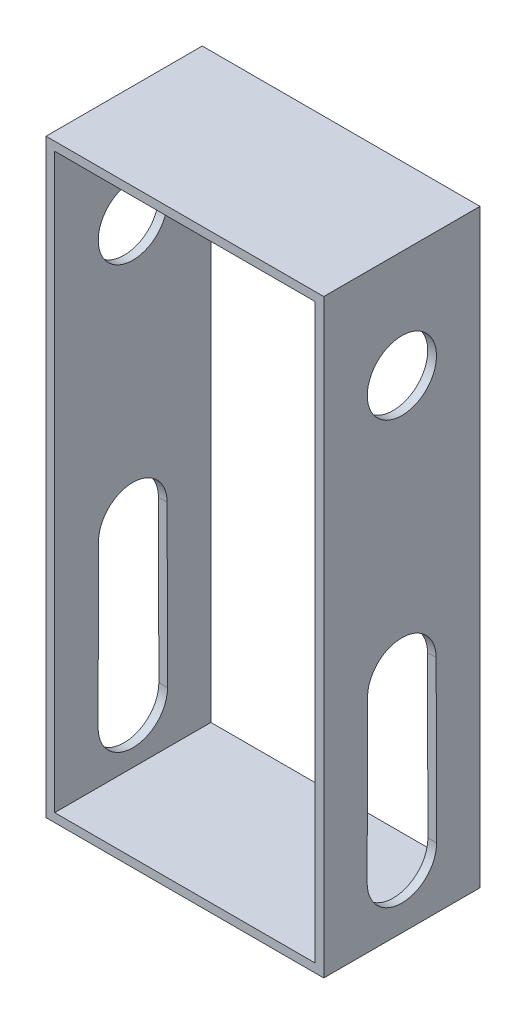
from build123d import *

# Parameters (mm, degrees)
SKETCH1_W               = 203.2
SKETCH1_H               = 431.8
SKETCH1_W_2             = 190.5
SKETCH1_H_2             = 419.1
BOSS_EXTRUDE4_DEPTH     = 114.3
CUT_EXTRUDE3_DEPTH      = 141.986
CUT_EXTRUDE3_DEPTH_BACK = 204.216
SKETCH4_R               = 25.313218752


with BuildPart() as part:
    # Sketch1 → Boss-Extrude4 (new body)
    with BuildSketch(Plane.XY):
        Rectangle(SKETCH1_W, SKETCH1_H)
        Rectangle(SKETCH1_W_2, SKETCH1_H_2, mode=Mode.SUBTRACT)
    extrude(amount=BOSS_EXTRUDE4_DEPTH)

    # Sketch4 → Cut-Extrude3 (cut, two sides: drawn at the far end of the back side and taken through both)
    with BuildSketch(Plane(origin=(0, 0, 0), x_dir=(0, 0, -1), z_dir=(1, 0, 0)).offset(-CUT_EXTRUDE3_DEPTH_BACK)):
        with BuildLine():
            ThreePointArc((-32.047357803, -53.975), (-57.15, -28.872357803), (-82.252642197, -53.975))
            Line((-82.252642197, -53.975), (-82.55, -171.608124436))
            ThreePointArc((-82.55, -171.608124436), (-57.15, -197.008124436), (-31.75, -171.608124436))
            Line((-31.75, -171.608124436), (-32.047357803, -53.975))
        make_face()
        with Locations((-57.15, 137.213144343)):
            Circle(SKETCH4_R)
    extrude(amount=CUT_EXTRUDE3_DEPTH + CUT_EXTRUDE3_DEPTH_BACK, mode=Mode.SUBTRACT)


solid = part.part
